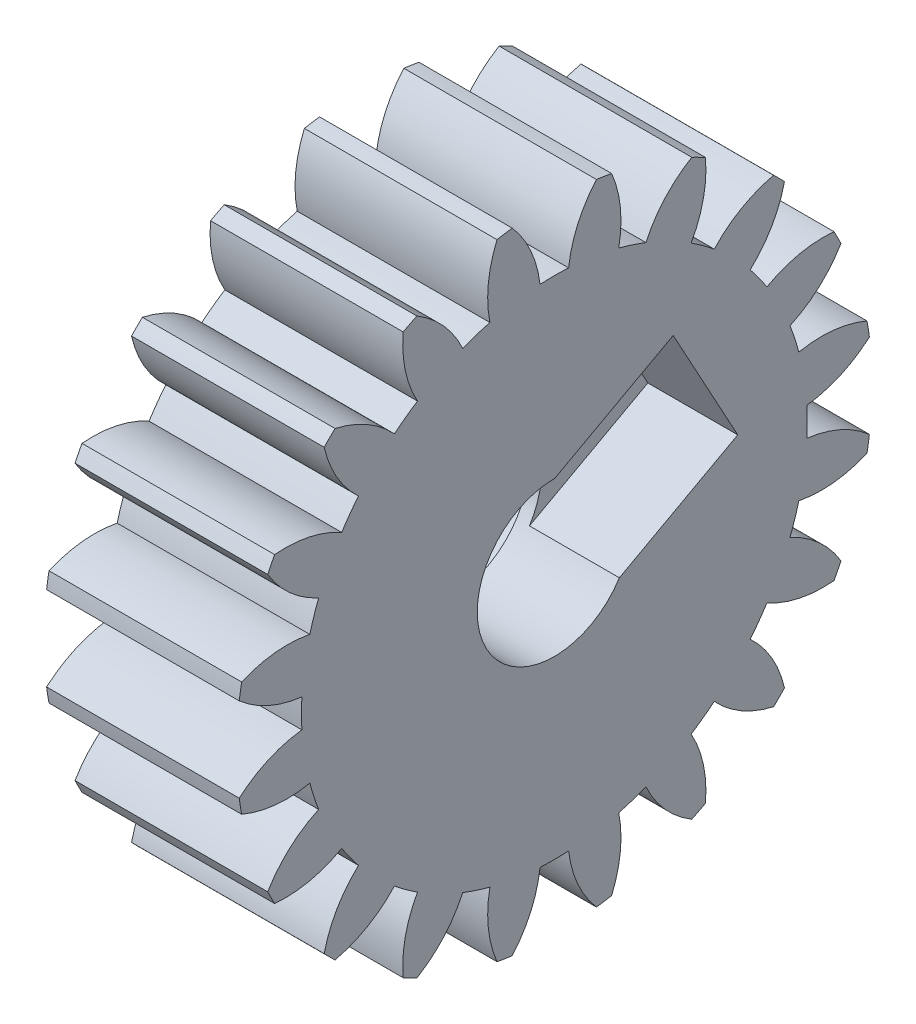
from build123d import *

# Parameters (mm, degrees)
BASPROSKE_W        = 15
BASPROSKE_H        = 24.75
TOOTHCUT_DEPTH     = 39.080506824
TEETHCUTS_COUNT    = 20
BORSKE_R           = 6
BORE_DEPTH         = 50.0000508
CUT_EXTRUDE1_DEPTH = 7
CUT_EXTRUDE2_DEPTH = 7


with BuildPart() as part:
    # BasProSke → Base-Revolve (revolve)
    with BuildSketch(Plane(origin=(0, 0, 0), x_dir=(1, 0, 0), z_dir=(0, 1, 0))):
        with Locations((7.5, 12.375)):
            Rectangle(BASPROSKE_W, BASPROSKE_H)
    revolve(axis=Axis((-10, 0, 0), (1, 0, 0)))

    # TooCutSke → ToothCut (cut, through all)
    with BuildSketch(Plane(origin=(0, 0, 0), x_dir=(0, 0, -1), z_dir=(1, 0, 0))):
        with BuildLine():
            ThreePointArc((1.111948432, 19.655071939), (0, 19.6865), (-1.111948432, 19.655071939))
            ThreePointArc((-1.111948432, 19.655071939), (-1.832349961, 22.271720111), (-3.300041734, 24.55463642))
            ThreePointArc((-3.300041734, 24.55463642), (0, 24.7754), (3.300041734, 24.55463642))
            ThreePointArc((3.300041734, 24.55463642), (1.832349961, 22.271720111), (1.111948432, 19.655071939))
        make_face()
    toothcut = extrude(amount=TOOTHCUT_DEPTH, mode=Mode.SUBTRACT)

    # TeethCuts: ToothCut ×20 about axis
    teethcuts_axis = Axis((-10, 0, 0), (1, 0, 0))
    for i in range(1, TEETHCUTS_COUNT):
        add(toothcut.rotate(teethcuts_axis, i * 360 / TEETHCUTS_COUNT), mode=Mode.SUBTRACT)

    # BorSke → Bore (cut, symmetric)
    with BuildSketch(Plane(origin=(0, 0, 0), x_dir=(0, 0, -1), z_dir=(1, 0, 0))):
        Circle(BORSKE_R)
    extrude(amount=BORE_DEPTH, both=True, mode=Mode.SUBTRACT)

    # Sketch1 → Cut-Extrude1 (cut)
    with BuildSketch(Plane(origin=(15, 0, 0), x_dir=(0, 0, -1), z_dir=(1, 0, 0))):
        with BuildLine():
            Line((9.25360376, 11.028159645), (0.035874537, 5.999892751))
            ThreePointArc((0.035874537, 5.999892751), (-5.267273842, -2.873295368), (5.064141431, -3.217836473))
            Line((5.064141431, -3.217836473), (14.281870655, 1.810430421))
            Line((14.281870655, 1.810430421), (9.25360376, 11.028159645))
        make_face()
    extrude(amount=-CUT_EXTRUDE1_DEPTH, mode=Mode.SUBTRACT)

    # Sketch2 → Cut-Extrude2 (cut)
    with BuildSketch(Plane.ZY):
        Polygon((12.46340215, -6.055048046), (11.475526504, 7.766098857), (-0.987875646, 13.821146903), (-12.46340215, 6.055048046), (-11.475526504, -7.766098857), (0.987875646, -13.821146903), align=None)
    extrude(amount=-CUT_EXTRUDE2_DEPTH, mode=Mode.SUBTRACT)


solid = part.part
